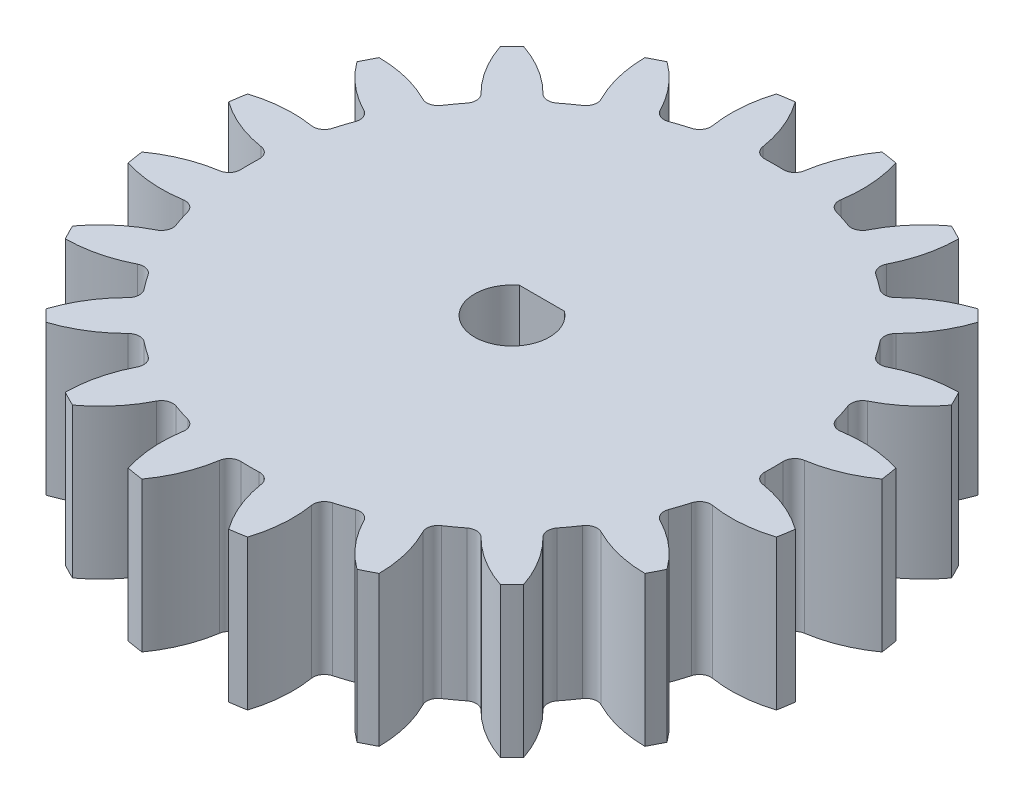
from build123d import *

# Parameters (mm, degrees)
SKETCH1_R                = 22
SKETCH1_R_2              = 2.5
BOSS_EXTRUDE1_DEPTH      = 10
CUT_EXTRUDE1_DEPTH       = 33.680269277
FILLET1_R                = 0.76
CIRPATTERN2_COUNT        = 20
FILLET1_OF_CIRPATTERN2_R = 0.76
BOSS_EXTRUDE2_DEPTH      = 10


with BuildPart() as part:
    # Sketch1 → Boss-Extrude1 (new body)
    with BuildSketch(Plane(origin=(0, 0, 0), x_dir=(1, 0, 0), z_dir=(0, 1, 0))):
        Circle(SKETCH1_R)
        Circle(SKETCH1_R_2, mode=Mode.SUBTRACT)
    extrude(amount=BOSS_EXTRUDE1_DEPTH)

    # Sketch2 → Cut-Extrude1 (cut, through all)
    with BuildSketch(Plane(origin=(0, 10, 0), x_dir=(1, 0, 0), z_dir=(0, 1, 0))):
        with BuildLine():
            ThreePointArc((1.310279948, 17.450878673), (0, 17.5), (-1.310279948, 17.450878673))
            ThreePointArc((-1.310279948, 17.450878673), (-1.802788979, 19.73907503), (-2.89632944, 21.808513837))
            ThreePointArc((-2.89632944, 21.808513837), (0, 22), (2.89632944, 21.808513837))
            ThreePointArc((2.89632944, 21.808513837), (1.802788979, 19.73907503), (1.310279948, 17.450878673))
        make_face()
    cut_extrude1 = extrude(amount=-CUT_EXTRUDE1_DEPTH, mode=Mode.SUBTRACT)

    # Fillet1
    fillet1_edges = [part.edges().sort_by_distance(p)[0] for p in [
        (1.310279948, 5, -17.450878673),
        (-1.310279948, 5, -17.450878673),
    ]]
    fillet(fillet1_edges, radius=FILLET1_R)

    # CirPattern2: Cut-Extrude1 ×20 about axis
    cirpattern2_axis = Axis((0, 10, 0), (0, 1, 0))
    for i in range(1, CIRPATTERN2_COUNT):
        add(cut_extrude1.rotate(cirpattern2_axis, i * 360 / CIRPATTERN2_COUNT), mode=Mode.SUBTRACT)

    # Fillet1 of CirPattern2
    fillet1_of_cirpattern2_edges = [part.edges().sort_by_distance(p)[0] for p in [
        (-4.146467794, 5, -17.001670648),
        (-6.63876836, 5, -16.191873106),
        (-9.197330378, 5, -14.888220643),
        (-11.317407869, 5, -13.347894183),
        (-13.347894183, 5, -11.317407869),
        (-14.888220643, 5, -9.197330378),
        (-16.191873106, 5, -6.63876836),
        (-17.001670648, 5, -4.146467794),
        (-17.450878673, 5, -1.310279948),
        (-17.450878673, 5, 1.310279948),
        (-17.001670648, 5, 4.146467794),
        (-16.191873106, 5, 6.63876836),
        (-14.888220643, 5, 9.197330378),
        (-13.347894183, 5, 11.317407869),
        (-11.317407869, 5, 13.347894183),
        (-9.197330378, 5, 14.888220643),
        (-6.63876836, 5, 16.191873106),
        (-4.146467794, 5, 17.001670648),
        (-1.310279948, 5, 17.450878673),
        (1.310279948, 5, 17.450878673),
        (4.146467794, 5, 17.001670648),
        (6.63876836, 5, 16.191873106),
        (9.197330378, 5, 14.888220643),
        (11.317407869, 5, 13.347894183),
        (13.347894183, 5, 11.317407869),
        (14.888220643, 5, 9.197330378),
        (16.191873106, 5, 6.63876836),
        (17.001670648, 5, 4.146467794),
        (17.450878673, 5, 1.310279948),
        (17.450878673, 5, -1.310279948),
        (17.001670648, 5, -4.146467794),
        (16.191873106, 5, -6.63876836),
        (14.888220643, 5, -9.197330378),
        (13.347894183, 5, -11.317407869),
        (11.317407869, 5, -13.347894183),
        (9.197330378, 5, -14.888220643),
        (6.63876836, 5, -16.191873106),
        (4.146467794, 5, -17.001670648),
    ]]
    fillet(fillet1_of_cirpattern2_edges, radius=FILLET1_OF_CIRPATTERN2_R)

    # Sketch4 → Boss-Extrude2 (add)
    with BuildSketch(Plane(origin=(0, 0, 0), x_dir=(1, 0, 0), z_dir=(0, 1, 0))):
        with BuildLine():
            Line((-1.5, 2), (1.5, 2))
            ThreePointArc((1.5, 2), (0, 2.5), (-1.5, 2))
        make_face()
    extrude(amount=BOSS_EXTRUDE2_DEPTH)


solid = part.part
